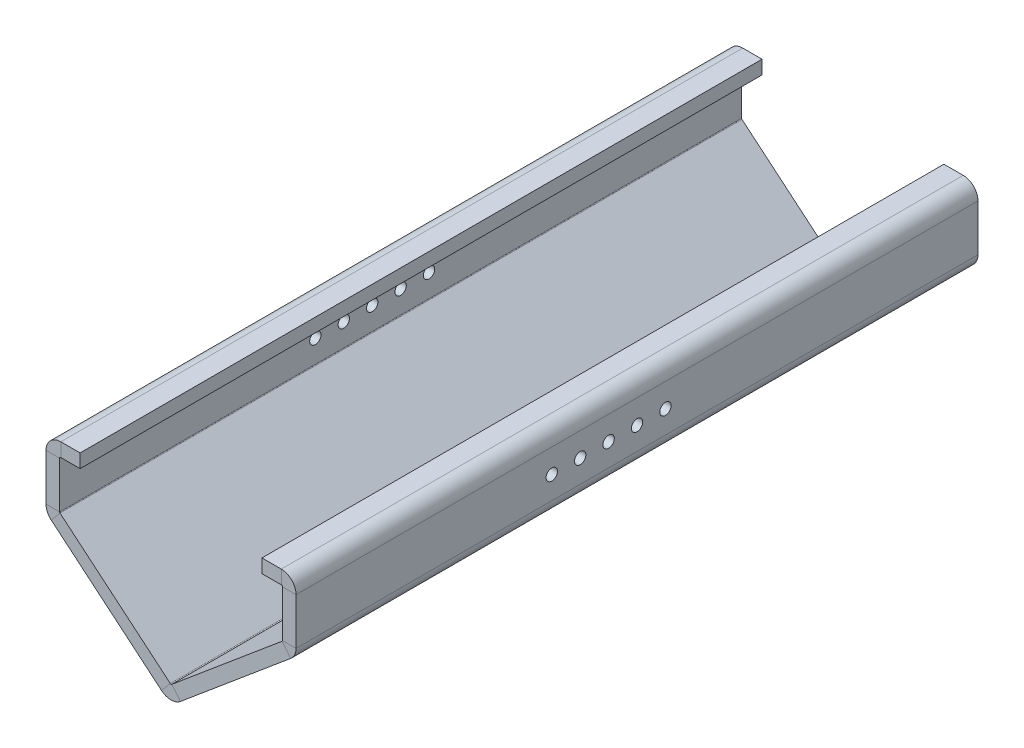
from build123d import *

# Parameters (mm, degrees)
BASE_FLANGE2_DEPTH = 300
SKETCH10_R         = 2.5
CUT_EXTRUDE1_DEPTH = 140


# Sheet-metal steps are written as plain solids
with BuildPart() as part:
    # Sketch1 → Base-Flange2 (new body)
    with BuildSketch(Plane.XY):
        with BuildLine():
            Line((-40, 76.091212948), (-48.5, 76.091212948))
            ThreePointArc((-48.5, 76.091212948), (-53.096194078, 74.187407026), (-55, 69.591212948))
            Line((-55, 69.591212948), (-55, 49.12471643))
            ThreePointArc((-55, 49.12471643), (-54.390131323, 46.375834295), (-52.67496831, 44.142785116))
            Line((-52.67496831, 44.142785116), (-4.17496831, 3.498715517))
            ThreePointArc((-4.17496831, 3.498715517), (0, 1.98064683), (4.17496831, 3.498715517))
            Line((4.17496831, 3.498715517), (52.67496831, 44.142785116))
            ThreePointArc((52.67496831, 44.142785116), (54.390131323, 46.375834295), (55, 49.12471643))
            Line((55, 49.12471643), (55, 69.591212948))
            ThreePointArc((55, 69.591212948), (53.096194078, 74.187407026), (48.5, 76.091212948))
            Line((48.5, 76.091212948), (40, 76.091212948))
            Line((40, 76.091212948), (40, 70.091212948))
            Line((40, 70.091212948), (48.5, 70.091212948))
            ThreePointArc((48.5, 70.091212948), (48.853553391, 69.944766339), (49, 69.591212948))
            Line((49, 69.591212948), (49, 49.12471643))
            ThreePointArc((49, 49.12471643), (48.953087025, 48.913263958), (48.821151408, 48.741490944))
            Line((48.821151408, 48.741490944), (0.321151408, 8.097421345))
            ThreePointArc((0.321151408, 8.097421345), (0, 7.98064683), (-0.321151408, 8.097421345))
            Line((-0.321151408, 8.097421345), (-48.821151408, 48.741490944))
            ThreePointArc((-48.821151408, 48.741490944), (-48.953087025, 48.913263958), (-49, 49.12471643))
            Line((-49, 49.12471643), (-49, 69.591212948))
            ThreePointArc((-49, 69.591212948), (-48.853553391, 69.944766339), (-48.5, 70.091212948))
            Line((-48.5, 70.091212948), (-40, 70.091212948))
            Line((-40, 70.091212948), (-40, 76.091212948))
        make_face()
    extrude(amount=-BASE_FLANGE2_DEPTH)

    # Sketch10 → Cut-Extrude1 (cut)
    with BuildSketch(Plane.ZY.offset(55)):
        with Locations(Location((-112.5, 59.12471643, 0), (0, 0, 180))):
            Circle(SKETCH10_R)
        with Locations(Location((-125, 59.12471643, 0), (0, 0, 180))):
            Circle(SKETCH10_R)
        with Locations(Location((-137.5, 59.12471643, 0), (0, 0, 180))):
            Circle(SKETCH10_R)
        with Locations(Location((-150, 59.12471643, 0), (0, 0, 180))):
            Circle(SKETCH10_R)
        with Locations(Location((-162.5, 59.12471643, 0), (0, 0, 180))):
            Circle(SKETCH10_R)
    extrude(amount=-CUT_EXTRUDE1_DEPTH, mode=Mode.SUBTRACT)


solid = part.part
